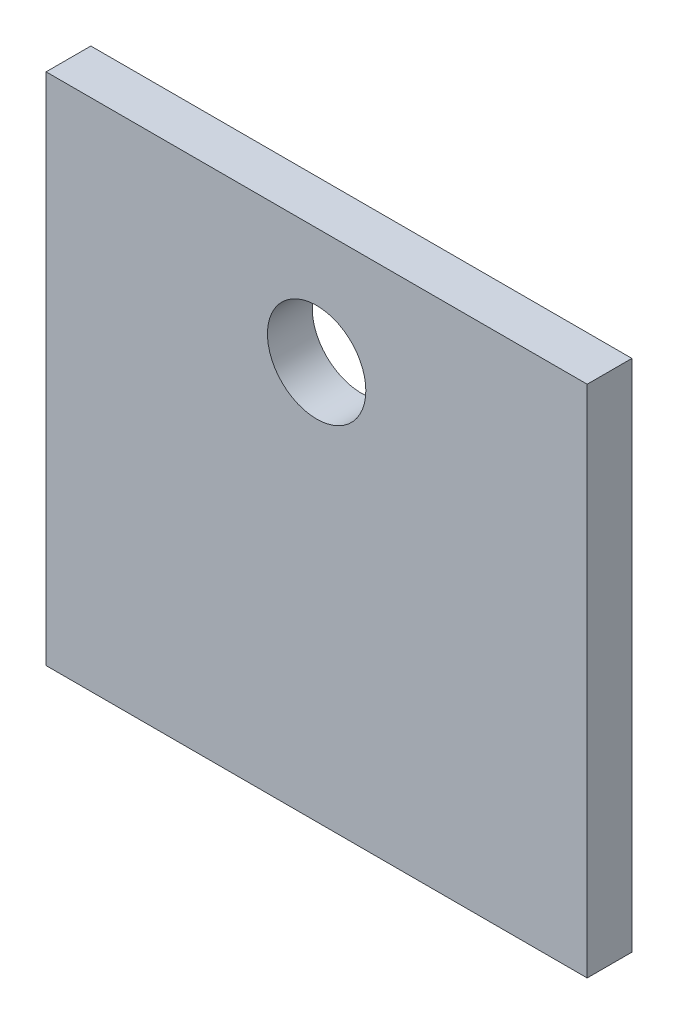
from build123d import *

# Parameters (mm, degrees)
SKETCH1_W           = 24.2
SKETCH1_H           = 23
BOSS_EXTRUDE1_DEPTH = 2
SKETCH2_R           = 2.2
CUT_EXTRUDE1_DEPTH  = 2


with BuildPart() as part:
    # Sketch1 → Boss-Extrude1 (new body)
    with BuildSketch(Plane.XY):
        Rectangle(SKETCH1_W, SKETCH1_H)
    extrude(amount=BOSS_EXTRUDE1_DEPTH)

    # Sketch2 → Cut-Extrude1 (cut)
    with BuildSketch(Plane.XY.offset(2)):
        with Locations((0, 6.3)):
            Circle(SKETCH2_R)
    extrude(amount=-CUT_EXTRUDE1_DEPTH, mode=Mode.SUBTRACT)


solid = part.part
